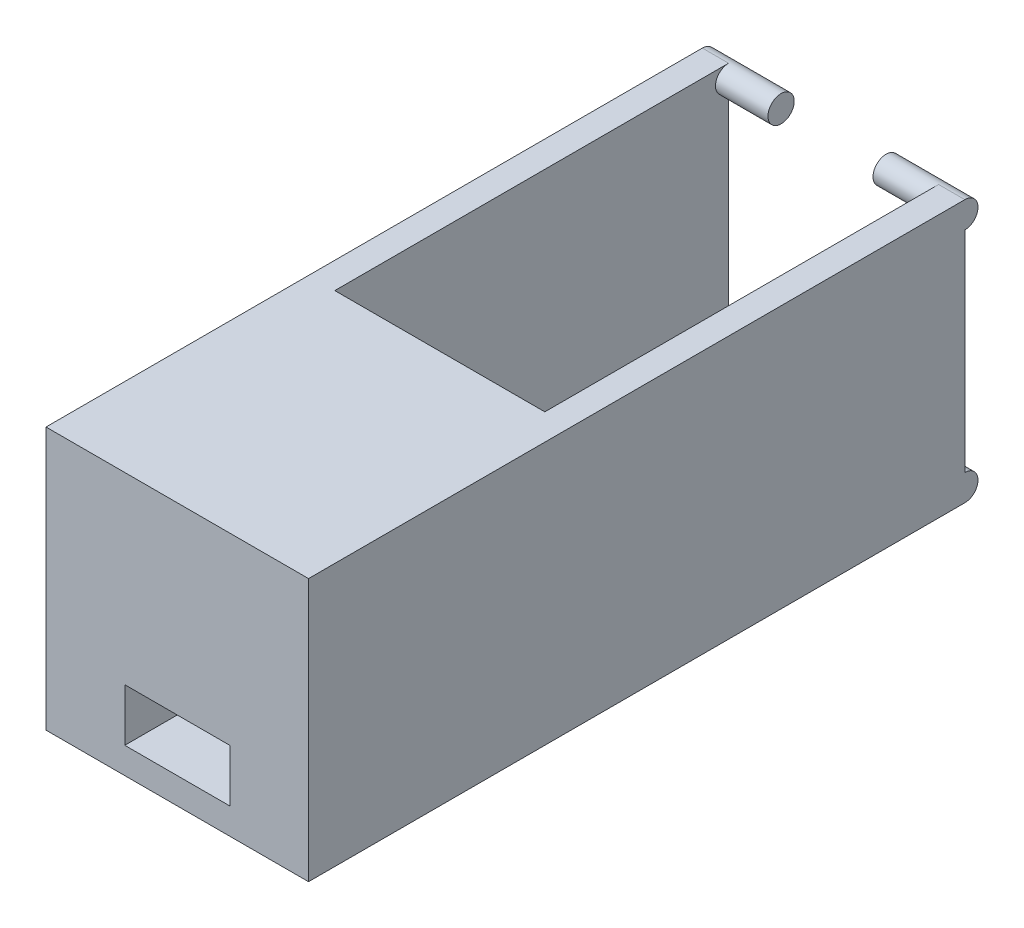
from build123d import *

# Parameters (mm, degrees)
SKETCH_1_W          = 20
SKETCH_1_H          = 50
EXTRUDE_1_DEPTH     = 20
SKETCH_2_W          = 16
SKETCH_2_H          = 30
CUT_EXTRUDE_1_DEPTH = 18
SKETCH_3_W          = 8
SKETCH_3_H          = 38.402735184
CUT_EXTRUDE_2_DEPTH = 18
SKETCH_4_R          = 1
EXTRUDE_2_DEPTH     = 6
EXTRUDE_START       = -6
SKETCH_5_R          = 1
EXTRUDE_3_DEPTH     = 6
SKETCH_6_W          = 8
SKETCH_6_H          = 4
CUT_EXTRUDE_3_DEPTH = 30


with BuildPart() as part:
    # 草图1 → 凸台-拉伸1 (new body)
    with BuildSketch(Plane(origin=(0, 0, 0), x_dir=(1, 0, 0), z_dir=(0, 1, 0))):
        with Locations((0, 5)):
            Rectangle(SKETCH_1_W, SKETCH_1_H)
    extrude(amount=EXTRUDE_1_DEPTH)

    # 草图2 → 切除-拉伸1 (cut)
    with BuildSketch(Plane(origin=(0, 20, 0), x_dir=(1, 0, 0), z_dir=(0, 1, 0))):
        with Locations((0, 15)):
            Rectangle(SKETCH_2_W, SKETCH_2_H)
    extrude(amount=-CUT_EXTRUDE_1_DEPTH, mode=Mode.SUBTRACT)

    # 草图3 → 切除-拉伸2 (cut)
    with BuildSketch(Plane.XZ):
        with Locations((0, -23.201367592)):
            Rectangle(SKETCH_3_W, SKETCH_3_H)
    extrude(amount=-CUT_EXTRUDE_2_DEPTH, mode=Mode.SUBTRACT)

    # 草图4 → 凸台-拉伸2 (add)
    with BuildSketch(Plane(origin=(-4, 0, 0), x_dir=(0, 0, -1), z_dir=(1, 0, 0))):
        with Locations((30, 1)):
            Circle(SKETCH_4_R)
        with Locations((30, 19)):
            Circle(SKETCH_4_R)
    extrude(amount=-EXTRUDE_2_DEPTH)

    # 草图5 → 凸台-拉伸3 (add)
    with BuildSketch(Plane.ZY.offset(-4).offset(EXTRUDE_START)):
        with Locations((-30, 1)):
            Circle(SKETCH_5_R)
        with Locations((-30, 19)):
            Circle(SKETCH_5_R)
    extrude(amount=EXTRUDE_3_DEPTH)

    # 草图6 → 切除-拉伸3 (cut)
    with BuildSketch(Plane(origin=(0, 0, 0), x_dir=(-1, 0, 0), z_dir=(0, 0, -1))):
        with Locations((0, 4)):
            Rectangle(SKETCH_6_W, SKETCH_6_H)
    extrude(amount=-CUT_EXTRUDE_3_DEPTH, mode=Mode.SUBTRACT)


solid = part.part
